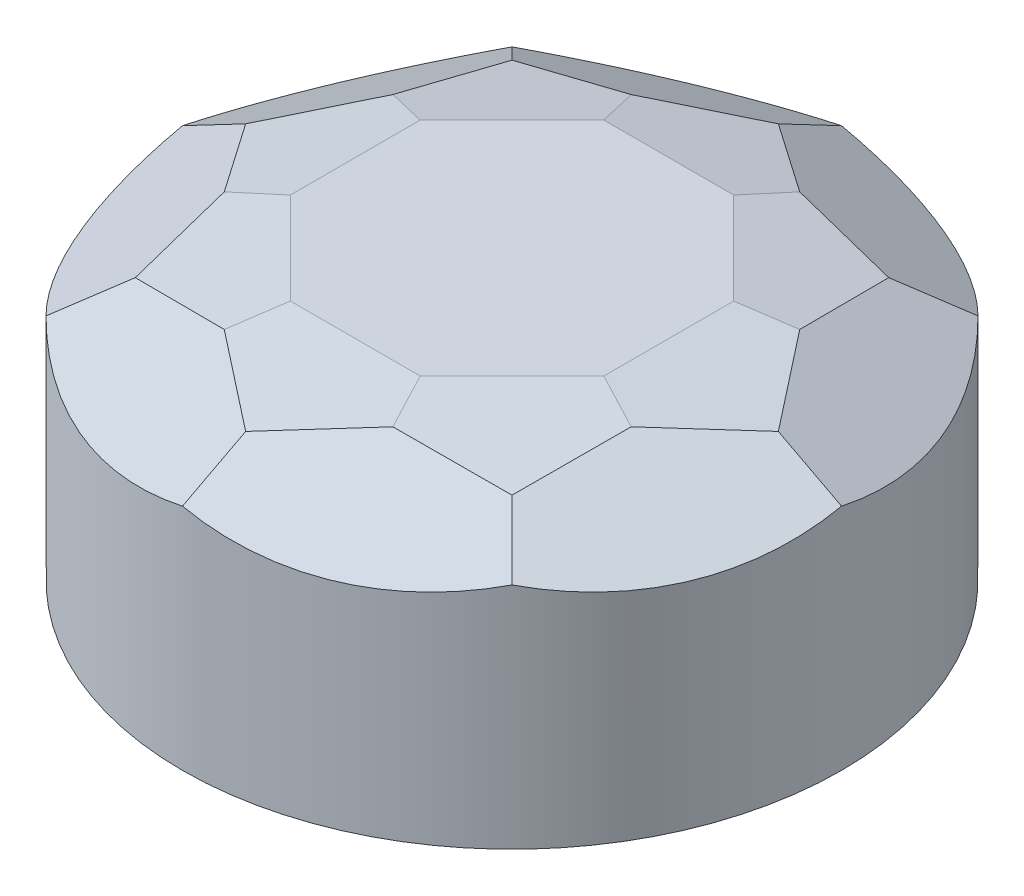
from build123d import *

# Parameters (mm, degrees)
SKETCH1_R           = 3.25
BOSS_EXTRUDE1_DEPTH = 4
BOSS_EXTRUDE2_DEPTH = 1
CHAMFER1_SIZE       = 0.88
CHAMFER1_SIZE_2     = 1
BOSS_EXTRUDE3_DEPTH = 0.5
CHAMFER2_SIZE       = 1.07
CHAMFER2_SIZE_2     = 0.5
SCALE1_SCALE_X      = 1
SCALE1_SCALE_Y      = 0.5
SCALE1_SCALE_Z      = 1
SKETCH4_R           = 3.45
SKETCH4_R_2         = 3.15
CUT_EXTRUDE1_DEPTH  = 6.356071494


with BuildPart() as part:
    # Sketch1 → Boss-Extrude1 (new body)
    with BuildSketch(Plane(origin=(0, 0, 0), x_dir=(1, 0, 0), z_dir=(0, 1, 0))):
        with Locations(Location((0, 0, 0), (0, 0, 270))):
            Circle(SKETCH1_R)
    extrude(amount=BOSS_EXTRUDE1_DEPTH)

    # Sketch2 → Boss-Extrude2 (add)
    with BuildSketch(Plane(origin=(0, 4, 0), x_dir=(1, 0, 0), z_dir=(0, 1, 0))):
        Polygon((0, 2.556139813), (-1.807463795, 1.807463795), (-2.556139813, 0), (-1.807463795, -1.807463795), (0, -2.556139813), (1.807463795, -1.807463795), (2.556139813, 0), (1.807463795, 1.807463795), align=None)
    extrude(amount=BOSS_EXTRUDE2_DEPTH)

    # Chamfer1
    # the kernel refuses this chamfer: 1, 0.88 mm, written as the material it adds along each edge
    with BuildSketch(Plane(origin=(-4.18730229, 4, 0.821702415), x_dir=(-0.38268343236508967, 0, 0.9238795325112867), z_dir=(0.9238795325112868, 0, 0.38268343236508967))) as chamfer1_piece_1_section:
        Polygon((CHAMFER1_SIZE, 0), (0, -CHAMFER1_SIZE_2), (0, 0), align=None)
    chamfer1_piece_1 = extrude(amount=7.108221963, mode=Mode.PRIVATE)
    chamfer1_piece_1 = chamfer1_piece_1 & Plane(origin=(0, 4, 0), x_dir=(0, 0, 1), z_dir=(0, -1, 0)) * Cylinder(3.25, 19, mode=Mode.PRIVATE)
    chamfer1_piece_1 = split(chamfer1_piece_1, bisect_by=Plane(origin=(-2.504502352, 4, 0.124663858), z_dir=(0.9238795325112868, 0, -0.38268343236508956)), keep=Keep.TOP, mode=Mode.PRIVATE)
    chamfer1_piece_1 = split(chamfer1_piece_1, bisect_by=Plane(origin=(-2.960869844, 4, 3.782572258), z_dir=(-0.38268343236508945, 0, -0.9238795325112868)), keep=Keep.TOP, mode=Mode.PRIVATE)
    chamfer1_piece_1 = split(chamfer1_piece_1, bisect_by=Plane(origin=(-4.18730229, 5, 0.821702415), z_dir=(0, -1, 0)), keep=Keep.TOP, mode=Mode.PRIVATE)
    add(chamfer1_piece_1)
    with BuildSketch(Plane(origin=(-3.541901193, 4, -2.379838494), x_dir=(-0.9238795325112868, 0, 0.38268343236508956), z_dir=(0.38268343236508956, 0, 0.9238795325112868))) as chamfer1_piece_2_section:
        Polygon((CHAMFER1_SIZE, 0), (0, -CHAMFER1_SIZE_2), (0, 0), align=None)
    chamfer1_piece_2 = extrude(amount=7.108221963, mode=Mode.PRIVATE)
    chamfer1_piece_2 = chamfer1_piece_2 & Plane(origin=(0, 4, 0), x_dir=(0, 0, 1), z_dir=(0, -1, 0)) * Cylinder(3.25, 19, mode=Mode.PRIVATE)
    chamfer1_piece_2 = split(chamfer1_piece_2, bisect_by=Plane(origin=(-1.859101256, 4, -1.682799937), z_dir=(0.923879532511287, 0, 0.3826834323650895)), keep=Keep.TOP, mode=Mode.PRIVATE)
    chamfer1_piece_2 = split(chamfer1_piece_2, bisect_by=Plane(origin=(-4.768333639, 4, 0.581031349), z_dir=(0.38268343236508967, 0, -0.9238795325112868)), keep=Keep.TOP, mode=Mode.PRIVATE)
    chamfer1_piece_2 = split(chamfer1_piece_2, bisect_by=Plane(origin=(-3.541901193, 5, -2.379838494), z_dir=(0, -1, 0)), keep=Keep.TOP, mode=Mode.PRIVATE)
    add(chamfer1_piece_2)
    with BuildSketch(Plane(origin=(-0.821702415, 4, -4.18730229), x_dir=(-0.9238795325112868, 0, -0.3826834323650895), z_dir=(-0.3826834323650895, 0, 0.923879532511287))) as chamfer1_piece_3_section:
        Polygon((CHAMFER1_SIZE, 0), (0, -CHAMFER1_SIZE_2), (0, 0), align=None)
    chamfer1_piece_3 = extrude(amount=7.108221963, mode=Mode.PRIVATE)
    chamfer1_piece_3 = chamfer1_piece_3 & Plane(origin=(0, 4, 0), x_dir=(0, 0, 1), z_dir=(0, -1, 0)) * Cylinder(3.25, 19, mode=Mode.PRIVATE)
    chamfer1_piece_3 = split(chamfer1_piece_3, bisect_by=Plane(origin=(-0.124663858, 4, -2.504502352), z_dir=(0.38268343236508945, 0, 0.923879532511287)), keep=Keep.TOP, mode=Mode.PRIVATE)
    chamfer1_piece_3 = split(chamfer1_piece_3, bisect_by=Plane(origin=(-3.782572258, 4, -2.960869844), z_dir=(0.9238795325112868, 0, -0.38268343236508956)), keep=Keep.TOP, mode=Mode.PRIVATE)
    chamfer1_piece_3 = split(chamfer1_piece_3, bisect_by=Plane(origin=(-0.821702415, 5, -4.18730229), z_dir=(0, -1, 0)), keep=Keep.TOP, mode=Mode.PRIVATE)
    add(chamfer1_piece_3)
    with BuildSketch(Plane(origin=(2.379838494, 4, -3.541901193), x_dir=(-0.38268343236508945, 0, -0.923879532511287), z_dir=(-0.923879532511287, 0, 0.38268343236508945))) as chamfer1_piece_4_section:
        Polygon((CHAMFER1_SIZE, 0), (0, -CHAMFER1_SIZE_2), (0, 0), align=None)
    chamfer1_piece_4 = extrude(amount=7.108221963, mode=Mode.PRIVATE)
    chamfer1_piece_4 = chamfer1_piece_4 & Plane(origin=(0, 4, 0), x_dir=(0, 0, 1), z_dir=(0, -1, 0)) * Cylinder(3.25, 19, mode=Mode.PRIVATE)
    chamfer1_piece_4 = split(chamfer1_piece_4, bisect_by=Plane(origin=(1.682799937, 4, -1.859101256), z_dir=(-0.3826834323650897, 0, 0.9238795325112867)), keep=Keep.TOP, mode=Mode.PRIVATE)
    chamfer1_piece_4 = split(chamfer1_piece_4, bisect_by=Plane(origin=(-0.581031349, 4, -4.768333639), z_dir=(0.923879532511287, 0, 0.3826834323650895)), keep=Keep.TOP, mode=Mode.PRIVATE)
    chamfer1_piece_4 = split(chamfer1_piece_4, bisect_by=Plane(origin=(2.379838494, 5, -3.541901193), z_dir=(0, -1, 0)), keep=Keep.TOP, mode=Mode.PRIVATE)
    add(chamfer1_piece_4)
    with BuildSketch(Plane(origin=(4.18730229, 4, -0.821702415), x_dir=(0.3826834323650897, 0, -0.9238795325112867), z_dir=(-0.9238795325112868, 0, -0.3826834323650898))) as chamfer1_piece_5_section:
        Polygon((CHAMFER1_SIZE, 0), (0, -CHAMFER1_SIZE_2), (0, 0), align=None)
    chamfer1_piece_5 = extrude(amount=7.108221963, mode=Mode.PRIVATE)
    chamfer1_piece_5 = chamfer1_piece_5 & Plane(origin=(0, 4, 0), x_dir=(0, 0, 1), z_dir=(0, -1, 0)) * Cylinder(3.25, 19, mode=Mode.PRIVATE)
    chamfer1_piece_5 = split(chamfer1_piece_5, bisect_by=Plane(origin=(2.960869844, 4, -3.782572258), z_dir=(0.38268343236508945, 0, 0.923879532511287)), keep=Keep.TOP, mode=Mode.PRIVATE)
    chamfer1_piece_5 = split(chamfer1_piece_5, bisect_by=Plane(origin=(2.504502352, 4, -0.124663858), z_dir=(-0.923879532511287, 0, 0.3826834323650893)), keep=Keep.TOP, mode=Mode.PRIVATE)
    chamfer1_piece_5 = split(chamfer1_piece_5, bisect_by=Plane(origin=(4.18730229, 5, -0.821702415), z_dir=(0, -1, 0)), keep=Keep.TOP, mode=Mode.PRIVATE)
    add(chamfer1_piece_5)
    with BuildSketch(Plane(origin=(3.541901193, 4, 2.379838494), x_dir=(0.9238795325112868, 0, -0.3826834323650893), z_dir=(-0.3826834323650893, 0, -0.923879532511287))) as chamfer1_piece_6_section:
        Polygon((CHAMFER1_SIZE, 0), (0, -CHAMFER1_SIZE_2), (0, 0), align=None)
    chamfer1_piece_6 = extrude(amount=7.108221963, mode=Mode.PRIVATE)
    chamfer1_piece_6 = chamfer1_piece_6 & Plane(origin=(0, 4, 0), x_dir=(0, 0, 1), z_dir=(0, -1, 0)) * Cylinder(3.25, 19, mode=Mode.PRIVATE)
    chamfer1_piece_6 = split(chamfer1_piece_6, bisect_by=Plane(origin=(1.859101256, 4, 1.682799937), z_dir=(-0.9238795325112867, 0, -0.3826834323650898)), keep=Keep.TOP, mode=Mode.PRIVATE)
    chamfer1_piece_6 = split(chamfer1_piece_6, bisect_by=Plane(origin=(4.768333639, 4, -0.581031349), z_dir=(-0.3826834323650897, 0, 0.9238795325112867)), keep=Keep.TOP, mode=Mode.PRIVATE)
    chamfer1_piece_6 = split(chamfer1_piece_6, bisect_by=Plane(origin=(3.541901193, 5, 2.379838494), z_dir=(0, -1, 0)), keep=Keep.TOP, mode=Mode.PRIVATE)
    add(chamfer1_piece_6)
    with BuildSketch(Plane(origin=(0.821702415, 4, 4.18730229), x_dir=(0.9238795325112867, 0, 0.3826834323650898), z_dir=(0.3826834323650898, 0, -0.9238795325112867))) as chamfer1_piece_7_section:
        Polygon((CHAMFER1_SIZE, 0), (0, -CHAMFER1_SIZE_2), (0, 0), align=None)
    chamfer1_piece_7 = extrude(amount=7.108221963, mode=Mode.PRIVATE)
    chamfer1_piece_7 = chamfer1_piece_7 & Plane(origin=(0, 4, 0), x_dir=(0, 0, 1), z_dir=(0, -1, 0)) * Cylinder(3.25, 19, mode=Mode.PRIVATE)
    chamfer1_piece_7 = split(chamfer1_piece_7, bisect_by=Plane(origin=(0.124663858, 4, 2.504502352), z_dir=(-0.38268343236508945, 0, -0.9238795325112868)), keep=Keep.TOP, mode=Mode.PRIVATE)
    chamfer1_piece_7 = split(chamfer1_piece_7, bisect_by=Plane(origin=(3.782572258, 4, 2.960869844), z_dir=(-0.923879532511287, 0, 0.3826834323650893)), keep=Keep.TOP, mode=Mode.PRIVATE)
    chamfer1_piece_7 = split(chamfer1_piece_7, bisect_by=Plane(origin=(0.821702415, 5, 4.18730229), z_dir=(0, -1, 0)), keep=Keep.TOP, mode=Mode.PRIVATE)
    add(chamfer1_piece_7)
    with BuildSketch(Plane(origin=(-2.379838494, 4, 3.541901193), x_dir=(0.3826834323650895, 0, 0.9238795325112868), z_dir=(0.923879532511287, 0, -0.3826834323650895))) as chamfer1_piece_8_section:
        Polygon((CHAMFER1_SIZE, 0), (0, -CHAMFER1_SIZE_2), (0, 0), align=None)
    chamfer1_piece_8 = extrude(amount=7.108221963, mode=Mode.PRIVATE)
    chamfer1_piece_8 = chamfer1_piece_8 & Plane(origin=(0, 4, 0), x_dir=(0, 0, 1), z_dir=(0, -1, 0)) * Cylinder(3.25, 19, mode=Mode.PRIVATE)
    chamfer1_piece_8 = split(chamfer1_piece_8, bisect_by=Plane(origin=(-1.682799937, 4, 1.859101256), z_dir=(0.38268343236508967, 0, -0.9238795325112868)), keep=Keep.TOP, mode=Mode.PRIVATE)
    chamfer1_piece_8 = split(chamfer1_piece_8, bisect_by=Plane(origin=(0.581031349, 4, 4.768333639), z_dir=(-0.9238795325112867, 0, -0.3826834323650898)), keep=Keep.TOP, mode=Mode.PRIVATE)
    chamfer1_piece_8 = split(chamfer1_piece_8, bisect_by=Plane(origin=(-2.379838494, 5, 3.541901193), z_dir=(0, -1, 0)), keep=Keep.TOP, mode=Mode.PRIVATE)
    add(chamfer1_piece_8)
    with BuildSketch(Plane(origin=(-3.541901193, 4, -2.379838494), x_dir=(-0.9238795325112868, 0, 0.38268343236508956), z_dir=(0.38268343236508956, 0, 0.9238795325112868))) as chamfer1_piece_9a_section:
        Polygon((CHAMFER1_SIZE, 0), (0, -CHAMFER1_SIZE_2), (0, 0), align=None)
    chamfer1_piece_9a = extrude(amount=7.108221963, mode=Mode.PRIVATE)
    chamfer1_piece_9a = chamfer1_piece_9a & Plane(origin=(0, 4, 0), x_dir=(0, 0, 1), z_dir=(0, -1, 0)) * Cylinder(3.25, 19, mode=Mode.PRIVATE)
    chamfer1_piece_9a = split(chamfer1_piece_9a, bisect_by=Plane(origin=(-4.768333639, 4, 0.581031349), z_dir=(-0.38268343236508967, 0, 0.9238795325112868)), keep=Keep.TOP, mode=Mode.PRIVATE)
    chamfer1_piece_9a = split(chamfer1_piece_9a, bisect_by=Plane(origin=(-3.541901193, 5, -2.379838494), z_dir=(0, -1, 0)), keep=Keep.TOP, mode=Mode.PRIVATE)
    with BuildSketch(Plane(origin=(-4.18730229, 4, 0.821702415), x_dir=(-0.38268343236508967, 0, 0.9238795325112867), z_dir=(0.9238795325112868, 0, 0.38268343236508967))) as chamfer1_piece_9b_section:
        Polygon((CHAMFER1_SIZE, 0), (0, -CHAMFER1_SIZE_2), (0, 0), align=None)
    chamfer1_piece_9b = extrude(amount=7.108221963, mode=Mode.PRIVATE)
    chamfer1_piece_9b = chamfer1_piece_9b & Plane(origin=(0, 4, 0), x_dir=(0, 0, 1), z_dir=(0, -1, 0)) * Cylinder(3.25, 19, mode=Mode.PRIVATE)
    chamfer1_piece_9b = split(chamfer1_piece_9b, bisect_by=Plane(origin=(-2.504502352, 4, 0.124663858), z_dir=(-0.9238795325112868, 0, 0.38268343236508956)), keep=Keep.TOP, mode=Mode.PRIVATE)
    chamfer1_piece_9b = split(chamfer1_piece_9b, bisect_by=Plane(origin=(-4.18730229, 5, 0.821702415), z_dir=(0, -1, 0)), keep=Keep.TOP, mode=Mode.PRIVATE)
    chamfer1_piece_9 = chamfer1_piece_9a & chamfer1_piece_9b
    add(chamfer1_piece_9)
    with BuildSketch(Plane(origin=(-4.18730229, 4, 0.821702415), x_dir=(-0.38268343236508967, 0, 0.9238795325112867), z_dir=(0.9238795325112868, 0, 0.38268343236508967))) as chamfer1_piece_10a_section:
        Polygon((CHAMFER1_SIZE, 0), (0, -CHAMFER1_SIZE_2), (0, 0), align=None)
    chamfer1_piece_10a = extrude(amount=7.108221963, mode=Mode.PRIVATE)
    chamfer1_piece_10a = chamfer1_piece_10a & Plane(origin=(0, 4, 0), x_dir=(0, 0, 1), z_dir=(0, -1, 0)) * Cylinder(3.25, 19, mode=Mode.PRIVATE)
    chamfer1_piece_10a = split(chamfer1_piece_10a, bisect_by=Plane(origin=(-2.960869844, 4, 3.782572258), z_dir=(0.38268343236508945, 0, 0.9238795325112868)), keep=Keep.TOP, mode=Mode.PRIVATE)
    chamfer1_piece_10a = split(chamfer1_piece_10a, bisect_by=Plane(origin=(-4.18730229, 5, 0.821702415), z_dir=(0, -1, 0)), keep=Keep.TOP, mode=Mode.PRIVATE)
    with BuildSketch(Plane(origin=(-2.379838494, 4, 3.541901193), x_dir=(0.3826834323650895, 0, 0.9238795325112868), z_dir=(0.923879532511287, 0, -0.3826834323650895))) as chamfer1_piece_10b_section:
        Polygon((CHAMFER1_SIZE, 0), (0, -CHAMFER1_SIZE_2), (0, 0), align=None)
    chamfer1_piece_10b = extrude(amount=7.108221963, mode=Mode.PRIVATE)
    chamfer1_piece_10b = chamfer1_piece_10b & Plane(origin=(0, 4, 0), x_dir=(0, 0, 1), z_dir=(0, -1, 0)) * Cylinder(3.25, 19, mode=Mode.PRIVATE)
    chamfer1_piece_10b = split(chamfer1_piece_10b, bisect_by=Plane(origin=(-1.682799937, 4, 1.859101256), z_dir=(-0.38268343236508967, 0, 0.9238795325112868)), keep=Keep.TOP, mode=Mode.PRIVATE)
    chamfer1_piece_10b = split(chamfer1_piece_10b, bisect_by=Plane(origin=(-2.379838494, 5, 3.541901193), z_dir=(0, -1, 0)), keep=Keep.TOP, mode=Mode.PRIVATE)
    chamfer1_piece_10 = chamfer1_piece_10a & chamfer1_piece_10b
    add(chamfer1_piece_10)
    with BuildSketch(Plane(origin=(-0.821702415, 4, -4.18730229), x_dir=(-0.9238795325112868, 0, -0.3826834323650895), z_dir=(-0.3826834323650895, 0, 0.923879532511287))) as chamfer1_piece_11a_section:
        Polygon((CHAMFER1_SIZE, 0), (0, -CHAMFER1_SIZE_2), (0, 0), align=None)
    chamfer1_piece_11a = extrude(amount=7.108221963, mode=Mode.PRIVATE)
    chamfer1_piece_11a = chamfer1_piece_11a & Plane(origin=(0, 4, 0), x_dir=(0, 0, 1), z_dir=(0, -1, 0)) * Cylinder(3.25, 19, mode=Mode.PRIVATE)
    chamfer1_piece_11a = split(chamfer1_piece_11a, bisect_by=Plane(origin=(-3.782572258, 4, -2.960869844), z_dir=(-0.9238795325112868, 0, 0.38268343236508956)), keep=Keep.TOP, mode=Mode.PRIVATE)
    chamfer1_piece_11a = split(chamfer1_piece_11a, bisect_by=Plane(origin=(-0.821702415, 5, -4.18730229), z_dir=(0, -1, 0)), keep=Keep.TOP, mode=Mode.PRIVATE)
    with BuildSketch(Plane(origin=(-3.541901193, 4, -2.379838494), x_dir=(-0.9238795325112868, 0, 0.38268343236508956), z_dir=(0.38268343236508956, 0, 0.9238795325112868))) as chamfer1_piece_11b_section:
        Polygon((CHAMFER1_SIZE, 0), (0, -CHAMFER1_SIZE_2), (0, 0), align=None)
    chamfer1_piece_11b = extrude(amount=7.108221963, mode=Mode.PRIVATE)
    chamfer1_piece_11b = chamfer1_piece_11b & Plane(origin=(0, 4, 0), x_dir=(0, 0, 1), z_dir=(0, -1, 0)) * Cylinder(3.25, 19, mode=Mode.PRIVATE)
    chamfer1_piece_11b = split(chamfer1_piece_11b, bisect_by=Plane(origin=(-1.859101256, 4, -1.682799937), z_dir=(-0.923879532511287, 0, -0.3826834323650895)), keep=Keep.TOP, mode=Mode.PRIVATE)
    chamfer1_piece_11b = split(chamfer1_piece_11b, bisect_by=Plane(origin=(-3.541901193, 5, -2.379838494), z_dir=(0, -1, 0)), keep=Keep.TOP, mode=Mode.PRIVATE)
    chamfer1_piece_11 = chamfer1_piece_11a & chamfer1_piece_11b
    add(chamfer1_piece_11)
    with BuildSketch(Plane(origin=(2.379838494, 4, -3.541901193), x_dir=(-0.38268343236508945, 0, -0.923879532511287), z_dir=(-0.923879532511287, 0, 0.38268343236508945))) as chamfer1_piece_12a_section:
        Polygon((CHAMFER1_SIZE, 0), (0, -CHAMFER1_SIZE_2), (0, 0), align=None)
    chamfer1_piece_12a = extrude(amount=7.108221963, mode=Mode.PRIVATE)
    chamfer1_piece_12a = chamfer1_piece_12a & Plane(origin=(0, 4, 0), x_dir=(0, 0, 1), z_dir=(0, -1, 0)) * Cylinder(3.25, 19, mode=Mode.PRIVATE)
    chamfer1_piece_12a = split(chamfer1_piece_12a, bisect_by=Plane(origin=(-0.581031349, 4, -4.768333639), z_dir=(-0.923879532511287, 0, -0.3826834323650895)), keep=Keep.TOP, mode=Mode.PRIVATE)
    chamfer1_piece_12a = split(chamfer1_piece_12a, bisect_by=Plane(origin=(2.379838494, 5, -3.541901193), z_dir=(0, -1, 0)), keep=Keep.TOP, mode=Mode.PRIVATE)
    with BuildSketch(Plane(origin=(-0.821702415, 4, -4.18730229), x_dir=(-0.9238795325112868, 0, -0.3826834323650895), z_dir=(-0.3826834323650895, 0, 0.923879532511287))) as chamfer1_piece_12b_section:
        Polygon((CHAMFER1_SIZE, 0), (0, -CHAMFER1_SIZE_2), (0, 0), align=None)
    chamfer1_piece_12b = extrude(amount=7.108221963, mode=Mode.PRIVATE)
    chamfer1_piece_12b = chamfer1_piece_12b & Plane(origin=(0, 4, 0), x_dir=(0, 0, 1), z_dir=(0, -1, 0)) * Cylinder(3.25, 19, mode=Mode.PRIVATE)
    chamfer1_piece_12b = split(chamfer1_piece_12b, bisect_by=Plane(origin=(-0.124663858, 4, -2.504502352), z_dir=(-0.38268343236508945, 0, -0.923879532511287)), keep=Keep.TOP, mode=Mode.PRIVATE)
    chamfer1_piece_12b = split(chamfer1_piece_12b, bisect_by=Plane(origin=(-0.821702415, 5, -4.18730229), z_dir=(0, -1, 0)), keep=Keep.TOP, mode=Mode.PRIVATE)
    chamfer1_piece_12 = chamfer1_piece_12a & chamfer1_piece_12b
    add(chamfer1_piece_12)
    with BuildSketch(Plane(origin=(2.379838494, 4, -3.541901193), x_dir=(-0.38268343236508945, 0, -0.923879532511287), z_dir=(-0.923879532511287, 0, 0.38268343236508945))) as chamfer1_piece_13a_section:
        Polygon((CHAMFER1_SIZE, 0), (0, -CHAMFER1_SIZE_2), (0, 0), align=None)
    chamfer1_piece_13a = extrude(amount=7.108221963, mode=Mode.PRIVATE)
    chamfer1_piece_13a = chamfer1_piece_13a & Plane(origin=(0, 4, 0), x_dir=(0, 0, 1), z_dir=(0, -1, 0)) * Cylinder(3.25, 19, mode=Mode.PRIVATE)
    chamfer1_piece_13a = split(chamfer1_piece_13a, bisect_by=Plane(origin=(1.682799937, 4, -1.859101256), z_dir=(0.3826834323650897, 0, -0.9238795325112867)), keep=Keep.TOP, mode=Mode.PRIVATE)
    chamfer1_piece_13a = split(chamfer1_piece_13a, bisect_by=Plane(origin=(2.379838494, 5, -3.541901193), z_dir=(0, -1, 0)), keep=Keep.TOP, mode=Mode.PRIVATE)
    with BuildSketch(Plane(origin=(4.18730229, 4, -0.821702415), x_dir=(0.3826834323650897, 0, -0.9238795325112867), z_dir=(-0.9238795325112868, 0, -0.3826834323650898))) as chamfer1_piece_13b_section:
        Polygon((CHAMFER1_SIZE, 0), (0, -CHAMFER1_SIZE_2), (0, 0), align=None)
    chamfer1_piece_13b = extrude(amount=7.108221963, mode=Mode.PRIVATE)
    chamfer1_piece_13b = chamfer1_piece_13b & Plane(origin=(0, 4, 0), x_dir=(0, 0, 1), z_dir=(0, -1, 0)) * Cylinder(3.25, 19, mode=Mode.PRIVATE)
    chamfer1_piece_13b = split(chamfer1_piece_13b, bisect_by=Plane(origin=(2.960869844, 4, -3.782572258), z_dir=(-0.38268343236508945, 0, -0.923879532511287)), keep=Keep.TOP, mode=Mode.PRIVATE)
    chamfer1_piece_13b = split(chamfer1_piece_13b, bisect_by=Plane(origin=(4.18730229, 5, -0.821702415), z_dir=(0, -1, 0)), keep=Keep.TOP, mode=Mode.PRIVATE)
    chamfer1_piece_13 = chamfer1_piece_13a & chamfer1_piece_13b
    add(chamfer1_piece_13)
    with BuildSketch(Plane(origin=(3.541901193, 4, 2.379838494), x_dir=(0.9238795325112868, 0, -0.3826834323650893), z_dir=(-0.3826834323650893, 0, -0.923879532511287))) as chamfer1_piece_14a_section:
        Polygon((CHAMFER1_SIZE, 0), (0, -CHAMFER1_SIZE_2), (0, 0), align=None)
    chamfer1_piece_14a = extrude(amount=7.108221963, mode=Mode.PRIVATE)
    chamfer1_piece_14a = chamfer1_piece_14a & Plane(origin=(0, 4, 0), x_dir=(0, 0, 1), z_dir=(0, -1, 0)) * Cylinder(3.25, 19, mode=Mode.PRIVATE)
    chamfer1_piece_14a = split(chamfer1_piece_14a, bisect_by=Plane(origin=(4.768333639, 4, -0.581031349), z_dir=(0.3826834323650897, 0, -0.9238795325112867)), keep=Keep.TOP, mode=Mode.PRIVATE)
    chamfer1_piece_14a = split(chamfer1_piece_14a, bisect_by=Plane(origin=(3.541901193, 5, 2.379838494), z_dir=(0, -1, 0)), keep=Keep.TOP, mode=Mode.PRIVATE)
    with BuildSketch(Plane(origin=(4.18730229, 4, -0.821702415), x_dir=(0.3826834323650897, 0, -0.9238795325112867), z_dir=(-0.9238795325112868, 0, -0.3826834323650898))) as chamfer1_piece_14b_section:
        Polygon((CHAMFER1_SIZE, 0), (0, -CHAMFER1_SIZE_2), (0, 0), align=None)
    chamfer1_piece_14b = extrude(amount=7.108221963, mode=Mode.PRIVATE)
    chamfer1_piece_14b = chamfer1_piece_14b & Plane(origin=(0, 4, 0), x_dir=(0, 0, 1), z_dir=(0, -1, 0)) * Cylinder(3.25, 19, mode=Mode.PRIVATE)
    chamfer1_piece_14b = split(chamfer1_piece_14b, bisect_by=Plane(origin=(2.504502352, 4, -0.124663858), z_dir=(0.923879532511287, 0, -0.3826834323650893)), keep=Keep.TOP, mode=Mode.PRIVATE)
    chamfer1_piece_14b = split(chamfer1_piece_14b, bisect_by=Plane(origin=(4.18730229, 5, -0.821702415), z_dir=(0, -1, 0)), keep=Keep.TOP, mode=Mode.PRIVATE)
    chamfer1_piece_14 = chamfer1_piece_14a & chamfer1_piece_14b
    add(chamfer1_piece_14)
    with BuildSketch(Plane(origin=(0.821702415, 4, 4.18730229), x_dir=(0.9238795325112867, 0, 0.3826834323650898), z_dir=(0.3826834323650898, 0, -0.9238795325112867))) as chamfer1_piece_15a_section:
        Polygon((CHAMFER1_SIZE, 0), (0, -CHAMFER1_SIZE_2), (0, 0), align=None)
    chamfer1_piece_15a = extrude(amount=7.108221963, mode=Mode.PRIVATE)
    chamfer1_piece_15a = chamfer1_piece_15a & Plane(origin=(0, 4, 0), x_dir=(0, 0, 1), z_dir=(0, -1, 0)) * Cylinder(3.25, 19, mode=Mode.PRIVATE)
    chamfer1_piece_15a = split(chamfer1_piece_15a, bisect_by=Plane(origin=(3.782572258, 4, 2.960869844), z_dir=(0.923879532511287, 0, -0.3826834323650893)), keep=Keep.TOP, mode=Mode.PRIVATE)
    chamfer1_piece_15a = split(chamfer1_piece_15a, bisect_by=Plane(origin=(0.821702415, 5, 4.18730229), z_dir=(0, -1, 0)), keep=Keep.TOP, mode=Mode.PRIVATE)
    with BuildSketch(Plane(origin=(3.541901193, 4, 2.379838494), x_dir=(0.9238795325112868, 0, -0.3826834323650893), z_dir=(-0.3826834323650893, 0, -0.923879532511287))) as chamfer1_piece_15b_section:
        Polygon((CHAMFER1_SIZE, 0), (0, -CHAMFER1_SIZE_2), (0, 0), align=None)
    chamfer1_piece_15b = extrude(amount=7.108221963, mode=Mode.PRIVATE)
    chamfer1_piece_15b = chamfer1_piece_15b & Plane(origin=(0, 4, 0), x_dir=(0, 0, 1), z_dir=(0, -1, 0)) * Cylinder(3.25, 19, mode=Mode.PRIVATE)
    chamfer1_piece_15b = split(chamfer1_piece_15b, bisect_by=Plane(origin=(1.859101256, 4, 1.682799937), z_dir=(0.9238795325112867, 0, 0.3826834323650898)), keep=Keep.TOP, mode=Mode.PRIVATE)
    chamfer1_piece_15b = split(chamfer1_piece_15b, bisect_by=Plane(origin=(3.541901193, 5, 2.379838494), z_dir=(0, -1, 0)), keep=Keep.TOP, mode=Mode.PRIVATE)
    chamfer1_piece_15 = chamfer1_piece_15a & chamfer1_piece_15b
    add(chamfer1_piece_15)
    with BuildSketch(Plane(origin=(-2.379838494, 4, 3.541901193), x_dir=(0.3826834323650895, 0, 0.9238795325112868), z_dir=(0.923879532511287, 0, -0.3826834323650895))) as chamfer1_piece_16a_section:
        Polygon((CHAMFER1_SIZE, 0), (0, -CHAMFER1_SIZE_2), (0, 0), align=None)
    chamfer1_piece_16a = extrude(amount=7.108221963, mode=Mode.PRIVATE)
    chamfer1_piece_16a = chamfer1_piece_16a & Plane(origin=(0, 4, 0), x_dir=(0, 0, 1), z_dir=(0, -1, 0)) * Cylinder(3.25, 19, mode=Mode.PRIVATE)
    chamfer1_piece_16a = split(chamfer1_piece_16a, bisect_by=Plane(origin=(0.581031349, 4, 4.768333639), z_dir=(0.9238795325112867, 0, 0.3826834323650898)), keep=Keep.TOP, mode=Mode.PRIVATE)
    chamfer1_piece_16a = split(chamfer1_piece_16a, bisect_by=Plane(origin=(-2.379838494, 5, 3.541901193), z_dir=(0, -1, 0)), keep=Keep.TOP, mode=Mode.PRIVATE)
    with BuildSketch(Plane(origin=(0.821702415, 4, 4.18730229), x_dir=(0.9238795325112867, 0, 0.3826834323650898), z_dir=(0.3826834323650898, 0, -0.9238795325112867))) as chamfer1_piece_16b_section:
        Polygon((CHAMFER1_SIZE, 0), (0, -CHAMFER1_SIZE_2), (0, 0), align=None)
    chamfer1_piece_16b = extrude(amount=7.108221963, mode=Mode.PRIVATE)
    chamfer1_piece_16b = chamfer1_piece_16b & Plane(origin=(0, 4, 0), x_dir=(0, 0, 1), z_dir=(0, -1, 0)) * Cylinder(3.25, 19, mode=Mode.PRIVATE)
    chamfer1_piece_16b = split(chamfer1_piece_16b, bisect_by=Plane(origin=(0.124663858, 4, 2.504502352), z_dir=(0.38268343236508945, 0, 0.9238795325112868)), keep=Keep.TOP, mode=Mode.PRIVATE)
    chamfer1_piece_16b = split(chamfer1_piece_16b, bisect_by=Plane(origin=(0.821702415, 5, 4.18730229), z_dir=(0, -1, 0)), keep=Keep.TOP, mode=Mode.PRIVATE)
    chamfer1_piece_16 = chamfer1_piece_16a & chamfer1_piece_16b
    add(chamfer1_piece_16)

    # Sketch3 → Boss-Extrude3 (add)
    with BuildSketch(Plane(origin=(0, 5, 0), x_dir=(1, 0, 0), z_dir=(0, 1, 0))):
        Polygon((-0.620628059, 1.498328678), (-1.498328678, 0.620628059), (-1.498328678, -0.620628059), (-0.620628059, -1.498328678), (0.620628059, -1.498328678), (1.498328678, -0.620628059), (1.498328678, 0.620628059), (0.620628059, 1.498328678), align=None)
    extrude(amount=BOSS_EXTRUDE3_DEPTH)

    # Chamfer2
    # the kernel refuses this chamfer: 1.07, 0.5 mm, written as the material it adds along each edge
    with BuildSketch(Plane(origin=(-3.458646846, 5, -1.339690109), x_dir=(-0.7071067811865447, 0, 0.7071067811865505), z_dir=(0.7071067811865505, 0, 0.7071067811865447))) as chamfer2_piece_1_section:
        Polygon((CHAMFER2_SIZE, 0), (0, -CHAMFER2_SIZE_2), (0, 0), align=None)
    chamfer2_piece_1 = extrude(amount=6.785873199, mode=Mode.PRIVATE)
    chamfer2_piece_1 = split(chamfer2_piece_1, bisect_by=Plane(origin=(-2.396940928, 7.441446714, 1.223494718), z_dir=(-0.2872856253788866, -0.6606278948920248, -0.6935688530644915)), keep=Keep.TOP, mode=Mode.PRIVATE)
    chamfer2_piece_1 = split(chamfer2_piece_1, bisect_by=Plane(origin=(-3.949447553, 6.128621167, -0.154792386), z_dir=(0.2872856253788866, -0.6606278948920248, -0.6935688530644915)), keep=Keep.TOP, mode=Mode.PRIVATE)
    chamfer2_piece_1 = split(chamfer2_piece_1, bisect_by=Plane(origin=(-2.757570472, 4.332221152, -1.049294767), z_dir=(0.6935688530644915, -0.6606278948920248, 0.2872856253788866)), keep=Keep.TOP, mode=Mode.PRIVATE)
    chamfer2_piece_1 = split(chamfer2_piece_1, bisect_by=Plane(origin=(-3.291443308, 4.840737771, -1.408948083), z_dir=(0.6935688530644915, -0.6606278948920248, -0.2872856253788866)), keep=Keep.TOP, mode=Mode.PRIVATE)
    chamfer2_piece_1 = split(chamfer2_piece_1, bisect_by=Plane(origin=(-3.29908018, 4.658527335, -1.339690109), z_dir=(0.42334893073604385, -0.9059667117751339, -1.0602427859705562e-15)), keep=Keep.TOP, mode=Mode.PRIVATE)
    chamfer2_piece_1 = split(chamfer2_piece_1, bisect_by=Plane(origin=(-3.458646846, 6.498881677, -0.639278111), z_dir=(-2.49914370978774e-15, -0.9059667117751338, -0.42334893073604396)), keep=Keep.TOP, mode=Mode.PRIVATE)
    add(chamfer2_piece_1)
    with BuildSketch(Plane(origin=(-1.498328678, 5, -3.3929366), x_dir=(-1, 0, 0), z_dir=(0, 0, 1))) as chamfer2_piece_2_section:
        Polygon((CHAMFER2_SIZE, 0), (0, -CHAMFER2_SIZE_2), (0, 0), align=None)
    chamfer2_piece_2 = extrude(amount=6.785873199, mode=Mode.PRIVATE)
    chamfer2_piece_2 = split(chamfer2_piece_2, bisect_by=Plane(origin=(-2.560034596, 7.441446714, -0.829751772), z_dir=(0.2872856253788866, -0.6606278948920248, -0.6935688530644915)), keep=Keep.TOP, mode=Mode.PRIVATE)
    chamfer2_piece_2 = split(chamfer2_piece_2, bisect_by=Plane(origin=(-1.207933335, 4.332221152, -2.691860225), z_dir=(0.2872856253788866, -0.6606278948920248, 0.6935688530644915)), keep=Keep.TOP, mode=Mode.PRIVATE)
    chamfer2_piece_2 = split(chamfer2_piece_2, bisect_by=Plane(origin=(-1.33112514, 4.840737771, -3.323678627), z_dir=(0.6935688530644915, -0.6606278948920248, 0.2872856253788866)), keep=Keep.TOP, mode=Mode.PRIVATE)
    chamfer2_piece_2 = split(chamfer2_piece_2, bisect_by=Plane(origin=(-2.683226401, 6.128621167, -2.902135893), z_dir=(0.6935688530644915, -0.6606278948920248, -0.2872856253788866)), keep=Keep.TOP, mode=Mode.PRIVATE)
    chamfer2_piece_2 = split(chamfer2_piece_2, bisect_by=Plane(origin=(-1.385498006, 4.658527335, -3.280105928), z_dir=(0.29935289973153084, -0.905966711775134, 0.29935289973153045)), keep=Keep.TOP, mode=Mode.PRIVATE)
    chamfer2_piece_2 = split(chamfer2_piece_2, bisect_by=Plane(origin=(-1.993594751, 6.498881677, -2.897670526), z_dir=(0.2993528997315294, -0.9059667117751339, -0.2993528997315318)), keep=Keep.TOP, mode=Mode.PRIVATE)
    add(chamfer2_piece_2)
    with BuildSketch(Plane(origin=(-3.3929366, 5, 1.498328678), x_dir=(0, 0, 1), z_dir=(1, 0, 0))) as chamfer2_piece_3_section:
        Polygon((CHAMFER2_SIZE, 0), (0, -CHAMFER2_SIZE_2), (0, 0), align=None)
    chamfer2_piece_3 = extrude(amount=6.785873199, mode=Mode.PRIVATE)
    chamfer2_piece_3 = split(chamfer2_piece_3, bisect_by=Plane(origin=(-2.902135893, 6.128621167, 2.683226401), z_dir=(-0.2872856253788866, -0.6606278948920248, -0.6935688530644915)), keep=Keep.TOP, mode=Mode.PRIVATE)
    chamfer2_piece_3 = split(chamfer2_piece_3, bisect_by=Plane(origin=(-0.829751772, 7.441446714, 2.560034596), z_dir=(-0.6935688530644915, -0.6606278948920248, -0.2872856253788866)), keep=Keep.TOP, mode=Mode.PRIVATE)
    chamfer2_piece_3 = split(chamfer2_piece_3, bisect_by=Plane(origin=(-3.323678627, 4.840737771, 1.33112514), z_dir=(0.2872856253788866, -0.6606278948920248, -0.6935688530644915)), keep=Keep.TOP, mode=Mode.PRIVATE)
    chamfer2_piece_3 = split(chamfer2_piece_3, bisect_by=Plane(origin=(-2.691860225, 4.332221152, 1.207933335), z_dir=(0.6935688530644915, -0.6606278948920248, -0.2872856253788866)), keep=Keep.TOP, mode=Mode.PRIVATE)
    chamfer2_piece_3 = split(chamfer2_piece_3, bisect_by=Plane(origin=(-3.280105928, 4.658527335, 1.385498006), z_dir=(0.2993528997315294, -0.9059667117751339, -0.2993528997315318)), keep=Keep.TOP, mode=Mode.PRIVATE)
    chamfer2_piece_3 = split(chamfer2_piece_3, bisect_by=Plane(origin=(-2.897670526, 6.498881677, 1.993594751), z_dir=(-0.299352899731533, -0.9059667117751338, -0.2993528997315284)), keep=Keep.TOP, mode=Mode.PRIVATE)
    add(chamfer2_piece_3)
    with BuildSketch(Plane(origin=(1.339690109, 5, -3.458646846), x_dir=(-0.707106781186548, 0, -0.707106781186547), z_dir=(-0.707106781186547, 0, 0.707106781186548))) as chamfer2_piece_4_section:
        Polygon((CHAMFER2_SIZE, 0), (0, -CHAMFER2_SIZE_2), (0, 0), align=None)
    chamfer2_piece_4 = extrude(amount=6.785873199, mode=Mode.PRIVATE)
    chamfer2_piece_4 = split(chamfer2_piece_4, bisect_by=Plane(origin=(1.408948083, 4.840737771, -3.291443308), z_dir=(0.2872856253788866, -0.6606278948920248, 0.6935688530644915)), keep=Keep.TOP, mode=Mode.PRIVATE)
    chamfer2_piece_4 = split(chamfer2_piece_4, bisect_by=Plane(origin=(1.049294767, 4.332221152, -2.757570472), z_dir=(-0.2872856253788866, -0.6606278948920248, 0.6935688530644915)), keep=Keep.TOP, mode=Mode.PRIVATE)
    chamfer2_piece_4 = split(chamfer2_piece_4, bisect_by=Plane(origin=(0.154792386, 6.128621167, -3.949447553), z_dir=(0.6935688530644915, -0.6606278948920248, 0.2872856253788866)), keep=Keep.TOP, mode=Mode.PRIVATE)
    chamfer2_piece_4 = split(chamfer2_piece_4, bisect_by=Plane(origin=(-1.223494718, 7.441446714, -2.396940928), z_dir=(0.6935688530644915, -0.6606278948920248, -0.2872856253788866)), keep=Keep.TOP, mode=Mode.PRIVATE)
    chamfer2_piece_4 = split(chamfer2_piece_4, bisect_by=Plane(origin=(1.339690109, 4.658527335, -3.29908018), z_dir=(2.499143709787781e-15, -0.9059667117751339, 0.4233489307360439)), keep=Keep.TOP, mode=Mode.PRIVATE)
    chamfer2_piece_4 = split(chamfer2_piece_4, bisect_by=Plane(origin=(0.639278111, 6.498881677, -3.458646846), z_dir=(0.42334893073604385, -0.9059667117751339, -1.0602427859705562e-15)), keep=Keep.TOP, mode=Mode.PRIVATE)
    add(chamfer2_piece_4)
    with BuildSketch(Plane(origin=(3.3929366, 5, -1.498328678), x_dir=(0, 0, -1), z_dir=(-1, 0, 0))) as chamfer2_piece_5_section:
        Polygon((CHAMFER2_SIZE, 0), (0, -CHAMFER2_SIZE_2), (0, 0), align=None)
    chamfer2_piece_5 = extrude(amount=6.785873199, mode=Mode.PRIVATE)
    chamfer2_piece_5 = split(chamfer2_piece_5, bisect_by=Plane(origin=(2.691860225, 4.332221152, -1.207933335), z_dir=(-0.6935688530644915, -0.6606278948920248, 0.2872856253788866)), keep=Keep.TOP, mode=Mode.PRIVATE)
    chamfer2_piece_5 = split(chamfer2_piece_5, bisect_by=Plane(origin=(2.902135893, 6.128621167, -2.683226401), z_dir=(0.2872856253788866, -0.6606278948920248, 0.6935688530644915)), keep=Keep.TOP, mode=Mode.PRIVATE)
    chamfer2_piece_5 = split(chamfer2_piece_5, bisect_by=Plane(origin=(3.323678627, 4.840737771, -1.33112514), z_dir=(-0.2872856253788866, -0.6606278948920248, 0.6935688530644915)), keep=Keep.TOP, mode=Mode.PRIVATE)
    chamfer2_piece_5 = split(chamfer2_piece_5, bisect_by=Plane(origin=(0.829751772, 7.441446714, -2.560034596), z_dir=(0.6935688530644915, -0.6606278948920248, 0.2872856253788866)), keep=Keep.TOP, mode=Mode.PRIVATE)
    chamfer2_piece_5 = split(chamfer2_piece_5, bisect_by=Plane(origin=(2.897670526, 6.498881677, -1.993594751), z_dir=(0.29935289973153084, -0.905966711775134, 0.29935289973153045)), keep=Keep.TOP, mode=Mode.PRIVATE)
    chamfer2_piece_5 = split(chamfer2_piece_5, bisect_by=Plane(origin=(3.280105928, 4.658527335, -1.385498006), z_dir=(-0.2993528997315273, -0.905966711775134, 0.299352899731534)), keep=Keep.TOP, mode=Mode.PRIVATE)
    add(chamfer2_piece_5)
    with BuildSketch(Plane(origin=(3.458646846, 5, 1.339690109), x_dir=(0.7071067811865396, 0, -0.7071067811865555), z_dir=(-0.7071067811865555, 0, -0.7071067811865397))) as chamfer2_piece_6_section:
        Polygon((CHAMFER2_SIZE, 0), (0, -CHAMFER2_SIZE_2), (0, 0), align=None)
    chamfer2_piece_6 = extrude(amount=6.785873199, mode=Mode.PRIVATE)
    chamfer2_piece_6 = split(chamfer2_piece_6, bisect_by=Plane(origin=(2.757570472, 4.332221152, 1.049294767), z_dir=(-0.6935688530644915, -0.6606278948920248, -0.2872856253788866)), keep=Keep.TOP, mode=Mode.PRIVATE)
    chamfer2_piece_6 = split(chamfer2_piece_6, bisect_by=Plane(origin=(3.291443308, 4.840737771, 1.408948083), z_dir=(-0.6935688530644915, -0.6606278948920248, 0.2872856253788866)), keep=Keep.TOP, mode=Mode.PRIVATE)
    chamfer2_piece_6 = split(chamfer2_piece_6, bisect_by=Plane(origin=(2.396940928, 7.441446714, -1.223494718), z_dir=(0.2872856253788866, -0.6606278948920248, 0.6935688530644915)), keep=Keep.TOP, mode=Mode.PRIVATE)
    chamfer2_piece_6 = split(chamfer2_piece_6, bisect_by=Plane(origin=(3.949447553, 6.128621167, 0.154792386), z_dir=(-0.2872856253788866, -0.6606278948920248, 0.6935688530644915)), keep=Keep.TOP, mode=Mode.PRIVATE)
    chamfer2_piece_6 = split(chamfer2_piece_6, bisect_by=Plane(origin=(3.458646846, 6.498881677, 0.639278111), z_dir=(2.499143709787781e-15, -0.9059667117751339, 0.4233489307360439)), keep=Keep.TOP, mode=Mode.PRIVATE)
    chamfer2_piece_6 = split(chamfer2_piece_6, bisect_by=Plane(origin=(3.29908018, 4.658527335, 1.339690109), z_dir=(-0.42334893073604385, -0.9059667117751339, 4.013776261174247e-15)), keep=Keep.TOP, mode=Mode.PRIVATE)
    add(chamfer2_piece_6)
    with BuildSketch(Plane(origin=(1.498328678, 5, 3.3929366), x_dir=(1, 0, 0), z_dir=(0, 0, -1))) as chamfer2_piece_7_section:
        Polygon((CHAMFER2_SIZE, 0), (0, -CHAMFER2_SIZE_2), (0, 0), align=None)
    chamfer2_piece_7 = extrude(amount=6.785873199, mode=Mode.PRIVATE)
    chamfer2_piece_7 = split(chamfer2_piece_7, bisect_by=Plane(origin=(1.207933335, 4.332221152, 2.691860225), z_dir=(-0.2872856253788866, -0.6606278948920248, -0.6935688530644915)), keep=Keep.TOP, mode=Mode.PRIVATE)
    chamfer2_piece_7 = split(chamfer2_piece_7, bisect_by=Plane(origin=(1.33112514, 4.840737771, 3.323678627), z_dir=(-0.6935688530644915, -0.6606278948920248, -0.2872856253788866)), keep=Keep.TOP, mode=Mode.PRIVATE)
    chamfer2_piece_7 = split(chamfer2_piece_7, bisect_by=Plane(origin=(2.683226401, 6.128621167, 2.902135893), z_dir=(-0.6935688530644915, -0.6606278948920248, 0.2872856253788866)), keep=Keep.TOP, mode=Mode.PRIVATE)
    chamfer2_piece_7 = split(chamfer2_piece_7, bisect_by=Plane(origin=(2.560034596, 7.441446714, 0.829751772), z_dir=(-0.2872856253788866, -0.6606278948920248, 0.6935688530644915)), keep=Keep.TOP, mode=Mode.PRIVATE)
    chamfer2_piece_7 = split(chamfer2_piece_7, bisect_by=Plane(origin=(1.385498006, 4.658527335, 3.280105928), z_dir=(-0.299352899731533, -0.9059667117751338, -0.2993528997315284)), keep=Keep.TOP, mode=Mode.PRIVATE)
    chamfer2_piece_7 = split(chamfer2_piece_7, bisect_by=Plane(origin=(1.993594751, 6.498881677, 2.897670526), z_dir=(-0.2993528997315273, -0.905966711775134, 0.299352899731534)), keep=Keep.TOP, mode=Mode.PRIVATE)
    add(chamfer2_piece_7)
    with BuildSketch(Plane(origin=(-1.339690109, 5, 3.458646846), x_dir=(0.707106781186553, 0, 0.7071067811865421), z_dir=(0.7071067811865421, 0, -0.7071067811865529))) as chamfer2_piece_8_section:
        Polygon((CHAMFER2_SIZE, 0), (0, -CHAMFER2_SIZE_2), (0, 0), align=None)
    chamfer2_piece_8 = extrude(amount=6.785873199, mode=Mode.PRIVATE)
    chamfer2_piece_8 = split(chamfer2_piece_8, bisect_by=Plane(origin=(-1.408948083, 4.840737771, 3.291443308), z_dir=(-0.2872856253788866, -0.6606278948920248, -0.6935688530644915)), keep=Keep.TOP, mode=Mode.PRIVATE)
    chamfer2_piece_8 = split(chamfer2_piece_8, bisect_by=Plane(origin=(-0.154792386, 6.128621167, 3.949447553), z_dir=(-0.6935688530644915, -0.6606278948920248, -0.2872856253788866)), keep=Keep.TOP, mode=Mode.PRIVATE)
    chamfer2_piece_8 = split(chamfer2_piece_8, bisect_by=Plane(origin=(-1.049294767, 4.332221152, 2.757570472), z_dir=(0.2872856253788866, -0.6606278948920248, -0.6935688530644915)), keep=Keep.TOP, mode=Mode.PRIVATE)
    chamfer2_piece_8 = split(chamfer2_piece_8, bisect_by=Plane(origin=(1.223494718, 7.441446714, 2.396940928), z_dir=(-0.6935688530644915, -0.6606278948920248, 0.2872856253788866)), keep=Keep.TOP, mode=Mode.PRIVATE)
    chamfer2_piece_8 = split(chamfer2_piece_8, bisect_by=Plane(origin=(-1.339690109, 4.658527335, 3.29908018), z_dir=(-2.49914370978774e-15, -0.9059667117751338, -0.42334893073604396)), keep=Keep.TOP, mode=Mode.PRIVATE)
    chamfer2_piece_8 = split(chamfer2_piece_8, bisect_by=Plane(origin=(-0.639278111, 6.498881677, 3.458646846), z_dir=(-0.42334893073604385, -0.9059667117751339, 4.013776261174247e-15)), keep=Keep.TOP, mode=Mode.PRIVATE)
    add(chamfer2_piece_8)


with BuildPart() as part_1:
    # Scale1: scaled about (0, 0, 0)
    add(part.part.scale((SCALE1_SCALE_X, SCALE1_SCALE_Y, SCALE1_SCALE_Z), about=(0, 0, 0)))

    # Sketch4 → Cut-Extrude1 (cut, through all)
    with BuildSketch(Plane.XZ):
        Circle(SKETCH4_R)
        with Locations(Location((0, 0, 0), (0, 0, 270))):
            Circle(SKETCH4_R_2, mode=Mode.SUBTRACT)
    extrude(amount=-CUT_EXTRUDE1_DEPTH, mode=Mode.SUBTRACT)


solid = part_1.part
